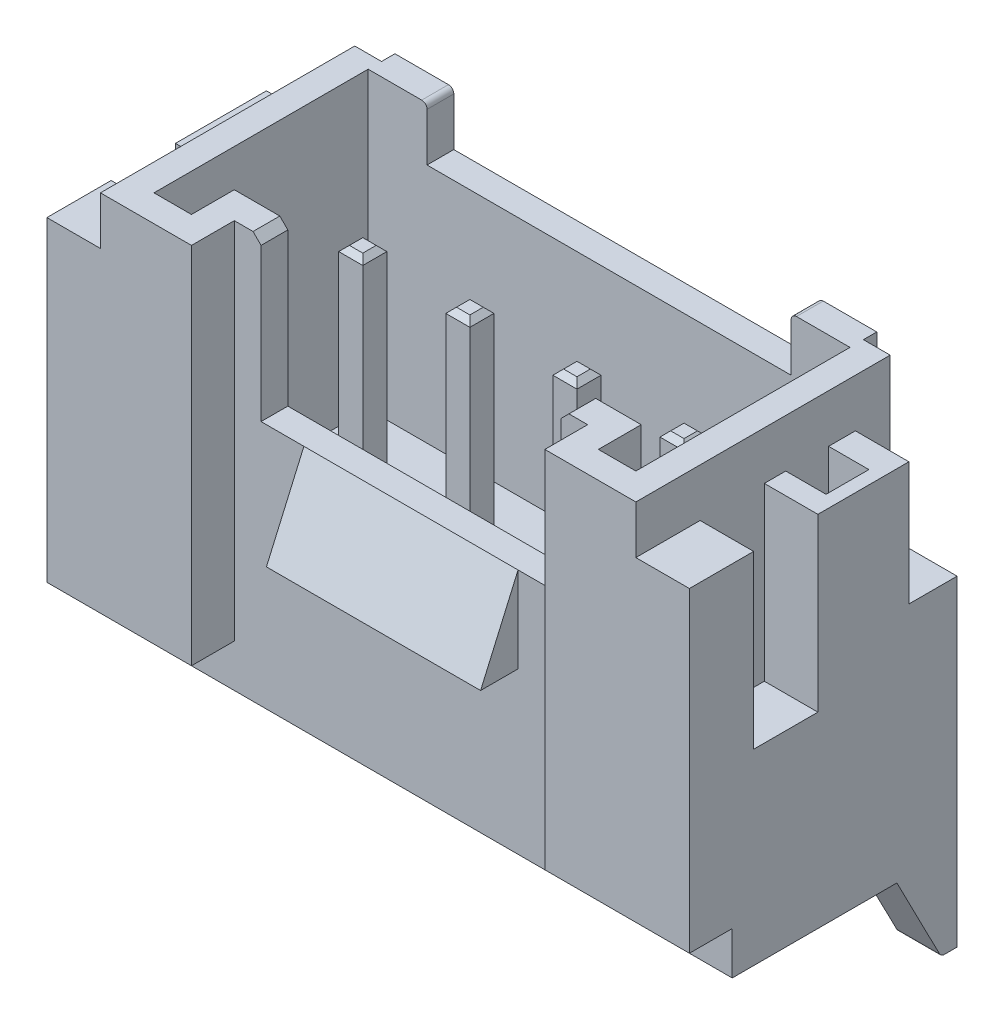
from build123d import *

# Parameters (mm, degrees)
ESQUISSE1_W                  = 10
ESQUISSE1_H                  = 5
BOSS_EXTRU_1_DEPTH           = 7.6
ESQUISSE2_W                  = 6.6
ESQUISSE2_H                  = 0.8
ENL_V_MAT_EXTRU_1_DEPTH      = 8
ENL_V_MAT_EXTRU_2_DEPTH      = 5.5
ESQUISSE5_W                  = 6.8
ESQUISSE5_H                  = 0.5
ENL_V_MAT_EXTRU_3_DEPTH      = 1
ESQUISSE6_W                  = 5.6
ESQUISSE6_H                  = 0.5
ENL_V_MAT_EXTRU_4_DEPTH      = 3
ESQUISSE8_W                  = 6.6
ESQUISSE8_H                  = 4.2
ENL_V_MAT_EXTRU_6_DEPTH      = 0.9
BOSS_EXTRU_2_DEPTH           = 6.8
BOSS_EXTRU_3_DEPTH           = 2
BOSS_EXTRU_3_DEPTH_BACK      = 2
ESQUISSE17_W                 = 1.25
ESQUISSE17_H                 = 4.2
BOSS_EXTRU_8_DEPTH           = 1
CHANFREIN1_SIZE              = 0.15
BOSS_EXTRU_5_DEPTH           = 0.45
BOSS_EXTRU_5_DEPTH_BACK      = 6.3
ESQUISSE13_W                 = 0.45
ESQUISSE13_H                 = 0.45
ESQUISSE18_W                 = 0.71
ESQUISSE18_H                 = 0.393329106
ESQUISSE18_W_2               = 0.715
BOSS_EXTRU_9_DEPTH           = 0.9
CHANFREIN2_SIZE              = 0.1
ESQUISSE14_W                 = 0.45
ESQUISSE14_H                 = 0.43
BOSS_EXTRU_6_DEPTH           = 1.875
CONG_1_R                     = 0.1
CONG_2_R                     = 0.1
ESQUISSE21_W                 = 1
ESQUISSE21_H                 = 5
BOSS_EXTRU_10_DEPTH          = 6.7
ESQUISSE22_W                 = 0.8
ESQUISSE22_H                 = 0.8
ENL_V_MAT_EXTRU_8_DEPTH      = 12
ENL_V_MAT_EXTRU_9_DEPTH      = 0.9
ENL_V_MAT_EXTRU_9_DEPTH_BACK = 2.3
ESQUISSE23_W                 = 0.752542273
ESQUISSE23_H                 = 0.8
ESQUISSE24_W                 = 1
ESQUISSE24_H                 = 1.2
ENL_V_MAT_EXTRU_10_DEPTH     = 3.2
ESQUISSE25_W                 = 0.45
ESQUISSE25_H                 = 0.45
BOSS_EXTRU_11_DEPTH          = 1.9
CONG_3_R                     = 0.1
CONG_4_R                     = 0.2
BOSS_EXTRU_12_DEPTH          = 0.8
BOSS_EXTRU_13_START          = -0.8
BOSS_EXTRU_13_DEPTH          = 0.8


with BuildPart() as part:
    # Esquisse1 → Boss.-Extru.1 (new body)
    with BuildSketch(Plane(origin=(0, 0, 0), x_dir=(1, 0, 0), z_dir=(0, 1, 0))):
        with Locations((5, 2.5)):
            Rectangle(ESQUISSE1_W, ESQUISSE1_H)
    extrude(amount=BOSS_EXTRU_1_DEPTH)

    # Esquisse2 → Enlèv. mat.-Extru.1 (cut)
    with BuildSketch(Plane(origin=(0, 7.6, 0), x_dir=(1, 0, 0), z_dir=(0, 1, 0))):
        with Locations((5, 0.4)):
            Rectangle(ESQUISSE2_W, ESQUISSE2_H)
    extrude(amount=-ENL_V_MAT_EXTRU_1_DEPTH, mode=Mode.SUBTRACT)

    # Esquisse4 → Enlèv. mat.-Extru.2 (cut)
    with BuildSketch(Plane(origin=(0, 7.6, 0), x_dir=(1, 0, 0), z_dir=(0, 1, 0))):
        Polygon((0.5, 0.5), (1.2, 0.5), (1.2, 1.3), (8.8, 1.3), (8.8, 0.5), (9.5, 0.5), (9.5, 4.5), (0.5, 4.5), align=None)
    extrude(amount=-ENL_V_MAT_EXTRU_2_DEPTH, mode=Mode.SUBTRACT)

    # Esquisse5 → Enlèv. mat.-Extru.3 (cut)
    with BuildSketch(Plane(origin=(0, 7.6, 0), x_dir=(1, 0, 0), z_dir=(0, 1, 0))):
        with Locations((5, 4.75)):
            Rectangle(ESQUISSE5_W, ESQUISSE5_H)
    extrude(amount=-ENL_V_MAT_EXTRU_3_DEPTH, mode=Mode.SUBTRACT)

    # Esquisse6 → Enlèv. mat.-Extru.4 (cut)
    with BuildSketch(Plane(origin=(0, 7.6, 0), x_dir=(1, 0, 0), z_dir=(0, 1, 0))):
        with Locations((5, 1.05)):
            Rectangle(ESQUISSE6_W, ESQUISSE6_H)
    extrude(amount=-ENL_V_MAT_EXTRU_4_DEPTH, mode=Mode.SUBTRACT)

    # Esquisse8 → Enlèv. mat.-Extru.6 (cut)
    with BuildSketch(Plane.XZ):
        with Locations((5, -2.9)):
            Rectangle(ESQUISSE8_W, ESQUISSE8_H)
    extrude(amount=-ENL_V_MAT_EXTRU_6_DEPTH, mode=Mode.SUBTRACT)

    # Esquisse9 → Boss.-Extru.2 (add)
    with BuildSketch(Plane(origin=(1.7, 0, 0), x_dir=(0, 0, -1), z_dir=(1, 0, 0))):
        Polygon((4.710085046, 0.977131832), (3.4, 0), (2.4, 0), (1.089914954, 0.977131832), align=None)
    extrude(amount=BOSS_EXTRU_2_DEPTH)

    # Esquisse11 → Boss.-Extru.3 (add, two sides: drawn at the far end of the back side and taken through both)
    with BuildSketch(Plane(origin=(5, 0, 0), x_dir=(0, 0, -1), z_dir=(1, 0, 0)).offset(-BOSS_EXTRU_3_DEPTH_BACK)):
        Polygon((0.8, 4.6), (0.1, 3), (0.8, 3), align=None)
    extrude(amount=BOSS_EXTRU_3_DEPTH + BOSS_EXTRU_3_DEPTH_BACK)

    # Esquisse17 → Boss.-Extru.8 (add)
    with BuildSketch(Plane(origin=(0, 1, 0), x_dir=(1, 0, 0), z_dir=(0, 1, 0))):
        with Locations((3.035, 2.9)):
            Rectangle(ESQUISSE17_W, ESQUISSE17_H)
        with Locations((5, 2.9)):
            Rectangle(ESQUISSE17_W, ESQUISSE17_H)
        with Locations((6.965, 2.9)):
            Rectangle(ESQUISSE17_W, ESQUISSE17_H)
    extrude(amount=-BOSS_EXTRU_8_DEPTH)

    # Chanfrein1
    chanfrein1_edges = [part.edges().sort_by_distance(p)[0] for p in [
        (2.2, 7.6, -1.05),
        (7.8, 7.6, -1.05),
    ]]
    chamfer(chanfrein1_edges, length=CHANFREIN1_SIZE)

    # Esquisse13 → Boss.-Extru.5 (add, two sides: drawn at the far end of the back side and taken through both)
    with BuildSketch(Plane.XZ.offset(-BOSS_EXTRU_5_DEPTH_BACK)):
        with Locations((4, -2.9)):
            Rectangle(ESQUISSE13_W, ESQUISSE13_H)
        with Locations((2, -2.9)):
            Rectangle(ESQUISSE13_W, ESQUISSE13_H)
        with Locations((8, -2.9)):
            Rectangle(ESQUISSE13_W, ESQUISSE13_H)
        with Locations((6, -2.9)):
            Rectangle(ESQUISSE13_W, ESQUISSE13_H)
    extrude(amount=BOSS_EXTRU_5_DEPTH + BOSS_EXTRU_5_DEPTH_BACK)

    # Esquisse18 → Boss.-Extru.9 (add)
    with BuildSketch(Plane.XZ.offset(-0.9)):
        with Locations((2.055, -0.996664553)):
            Rectangle(ESQUISSE18_W, ESQUISSE18_H)
        with Locations((4.0175, -0.996664553)):
            Rectangle(ESQUISSE18_W_2, ESQUISSE18_H)
        with Locations((5.9825, -0.996664553)):
            Rectangle(ESQUISSE18_W_2, ESQUISSE18_H)
        with Locations((7.945, -0.996664553)):
            Rectangle(ESQUISSE18_W, ESQUISSE18_H)
    extrude(amount=BOSS_EXTRU_9_DEPTH)

    # Chanfrein2
    chanfrein2_edges = [part.edges().sort_by_distance(p)[0] for p in [
        (4.225, 6.3, -2.9),
        (4, 6.3, -3.125),
        (3.775, 6.3, -2.9),
        (4, 6.3, -2.675),
        (2.225, 6.3, -2.9),
        (2, 6.3, -3.125),
        (1.775, 6.3, -2.9),
        (2, 6.3, -2.675),
        (8, 6.3, -3.125),
        (7.775, 6.3, -2.9),
        (8, 6.3, -2.675),
        (8.225, 6.3, -2.9),
        (6, 6.3, -3.125),
        (5.775, 6.3, -2.9),
        (6, 6.3, -2.675),
        (6.225, 6.3, -2.9),
    ]]
    chamfer(chanfrein2_edges, length=CHANFREIN2_SIZE)

    # Esquisse14 → Boss.-Extru.6 (add)
    with BuildSketch(Plane(origin=(0, 0, -3.125), x_dir=(-1, 0, 0), z_dir=(0, 0, -1))):
        with Locations((-8, -0.235)):
            Rectangle(ESQUISSE14_W, ESQUISSE14_H)
        with Locations((-6, -0.235)):
            Rectangle(ESQUISSE14_W, ESQUISSE14_H)
        with Locations((-4, -0.235)):
            Rectangle(ESQUISSE14_W, ESQUISSE14_H)
        with Locations((-2, -0.235)):
            Rectangle(ESQUISSE14_W, ESQUISSE14_H)
    extrude(amount=BOSS_EXTRU_6_DEPTH)

    # Congé1
    # the kernel refuses this fillet: 0.1 mm, written as the material it adds along each edge
    with BuildSketch(Plane(origin=(3.775, -0.02, -3.125), x_dir=(0, 0, -1), z_dir=(1, 0, 0)), Plane(origin=(5.775, -0.02, -3.125), x_dir=(0, 0, -1), z_dir=(1, 0, 0)), Plane(origin=(7.775, -0.02, -3.125), x_dir=(0, 0, -1), z_dir=(1, 0, 0)), Plane(origin=(1.775, -0.02, -3.125), x_dir=(0, 0, -1), z_dir=(1, 0, 0))) as cong_1_piece_1:
        with BuildLine():
            CenterArc((0.06, 0.1), CONG_1_R, 233.130102354, 36.869897646)
            Line((0, 0.02), (0, 0))
            Line((0, 0), (0.06, 0))
        make_face()
    extrude(amount=0.45)
    # the kernel refuses this fillet: 0.1 mm, written as the material it takes off along each edge
    with BuildSketch(Plane(origin=(8.475, -0.45, -2.675), x_dir=(0, 1, 0), z_dir=(-1, 0, 0)), Plane(origin=(6.475, -0.45, -2.675), x_dir=(0, 1, 0), z_dir=(-1, 0, 0))) as cong_1_2_piece_1:
        with BuildLine():
            CenterArc((CONG_1_R, CONG_1_R), CONG_1_R, 180, 90)
            Line((0, CONG_1_R), (0, 0))
            Line((0, 0), (CONG_1_R, 0))
        make_face()
    extrude(amount=0.95, mode=Mode.SUBTRACT)
    with BuildSketch(Plane(origin=(3.525, -0.45, -2.675), x_dir=(0, 1, 0), z_dir=(1, 0, 0)), Plane(origin=(1.525, -0.45, -2.675), x_dir=(0, 1, 0), z_dir=(1, 0, 0))) as cong_1_2_piece_2:
        with BuildLine():
            CenterArc((CONG_1_R, -CONG_1_R), CONG_1_R, 90, 90)
            Line((0, -CONG_1_R), (0, 0))
            Line((0, 0), (CONG_1_R, 0))
        make_face()
    extrude(amount=0.95, mode=Mode.SUBTRACT)

    # Congé2
    cong_2_edges = [part.edges().sort_by_distance(p)[0] for p in [
        (1.6, 7.6, -4.75),
        (8.4, 7.6, -4.75),
    ]]
    fillet(cong_2_edges, radius=CONG_2_R)

    # Esquisse21 → Boss.-Extru.10 (add)
    with BuildSketch(Plane(origin=(0, 6.7, 0), x_dir=(1, 0, 0), z_dir=(0, 1, 0))):
        with Locations((-0.5, 2.5)):
            Rectangle(ESQUISSE21_W, ESQUISSE21_H)
        with Locations((10.5, 2.5)):
            Rectangle(ESQUISSE21_W, ESQUISSE21_H)
    extrude(amount=-BOSS_EXTRU_10_DEPTH)

    # Esquisse22 → Enlèv. mat.-Extru.8 (cut)
    with BuildSketch(Plane(origin=(11, 0, 0), x_dir=(0, 0, -1), z_dir=(1, 0, 0))):
        with Locations((0.4, 0.4)):
            Rectangle(ESQUISSE22_W, ESQUISSE22_H)
    extrude(amount=-ENL_V_MAT_EXTRU_8_DEPTH, mode=Mode.SUBTRACT)

    # Esquisse23 → Enlèv. mat.-Extru.9 (cut, two sides: drawn at the far end of the back side and taken through both)
    with BuildSketch(Plane(origin=(0, 6.7, 0), x_dir=(1, 0, 0), z_dir=(0, 1, 0)).offset(-ENL_V_MAT_EXTRU_9_DEPTH_BACK)):
        Polygon((11, 5), (10, 5), (9.5, 5), (9.5, 4.75), (10, 4.75), (10, 4.1), (11, 4.1), align=None)
        with Locations((10.376271137, 3.2)):
            Rectangle(ESQUISSE23_W, ESQUISSE23_H)
        with Locations((-0.376271137, 3.2)):
            Rectangle(ESQUISSE23_W, ESQUISSE23_H)
        Polygon((0, 4.75), (0, 4.1), (-1, 4.1), (-1, 5), (0, 5), (0.5, 5), (0.5, 4.75), align=None)
    extrude(amount=ENL_V_MAT_EXTRU_9_DEPTH + ENL_V_MAT_EXTRU_9_DEPTH_BACK, mode=Mode.SUBTRACT)

    # Esquisse24 → Enlèv. mat.-Extru.10 (cut)
    with BuildSketch(Plane(origin=(0, 6.7, 0), x_dir=(1, 0, 0), z_dir=(0, 1, 0))):
        with Locations((10.5, 1.8)):
            Rectangle(ESQUISSE24_W, ESQUISSE24_H)
        with Locations((-0.5, 1.8)):
            Rectangle(ESQUISSE24_W, ESQUISSE24_H)
    extrude(amount=-ENL_V_MAT_EXTRU_10_DEPTH, mode=Mode.SUBTRACT)

    # Esquisse25 → Boss.-Extru.11 (add)
    with BuildSketch(Plane.XZ.offset(0.45)):
        with Locations((8, -4.775)):
            Rectangle(ESQUISSE25_W, ESQUISSE25_H)
        with Locations((6, -4.775)):
            Rectangle(ESQUISSE25_W, ESQUISSE25_H)
        with Locations((4, -4.775)):
            Rectangle(ESQUISSE25_W, ESQUISSE25_H)
        with Locations((2, -4.775)):
            Rectangle(ESQUISSE25_W, ESQUISSE25_H)
    extrude(amount=BOSS_EXTRU_11_DEPTH)

    # Congé3
    cong_3_edges = [part.edges().sort_by_distance(p)[0] for p in [
        (8, -0.02, -5),
        (6, -0.02, -5),
        (4, -0.02, -5),
        (2, -0.02, -5),
        (8, -0.45, -4.55),
        (6, -0.45, -4.55),
        (4, -0.45, -4.55),
        (2, -0.45, -4.55),
    ]]
    fillet(cong_3_edges, radius=CONG_3_R)

    # Congé4
    cong_4_edges = [part.edges().sort_by_distance(p)[0] for p in [
        (8, -2.35, -4.55),
        (6, -2.35, -4.55),
        (4, -2.35, -4.55),
        (2, -2.35, -4.55),
    ]]
    fillet(cong_4_edges, radius=CONG_4_R)

    # Esquisse27 → Boss.-Extru.12 (add)
    with BuildSketch(Plane.ZY.offset(1)):
        with BuildLine():
            Line((-5, 0), (-5, -1.6))
            Line((-5, -1.6), (-4.76096118, -1.6))
            ThreePointArc((-4.76096118, -1.6), (-4.708909419, -1.585385094), (-4.672072291, -1.545812285))
            Line((-4.672072291, -1.545812285), (-3.875378875, 0))
            Line((-3.875378875, 0), (-5, 0))
        make_face()
    extrude(amount=-BOSS_EXTRU_12_DEPTH)

    # Esquisse28 → Boss.-Extru.13 (add)
    with BuildSketch(Plane(origin=(11, 0, 0), x_dir=(0, 0, -1), z_dir=(1, 0, 0)).offset(BOSS_EXTRU_13_START)):
        with BuildLine():
            Line((5, -1.6), (5, 0))
            Line((5, 0), (3.875378875, 0))
            Line((3.875378875, 0), (4.672072291, -1.545812285))
            ThreePointArc((4.672072291, -1.545812285), (4.708909419, -1.585385094), (4.76096118, -1.6))
            Line((4.76096118, -1.6), (5, -1.6))
        make_face()
    extrude(amount=BOSS_EXTRU_13_DEPTH)


solid = part.part
